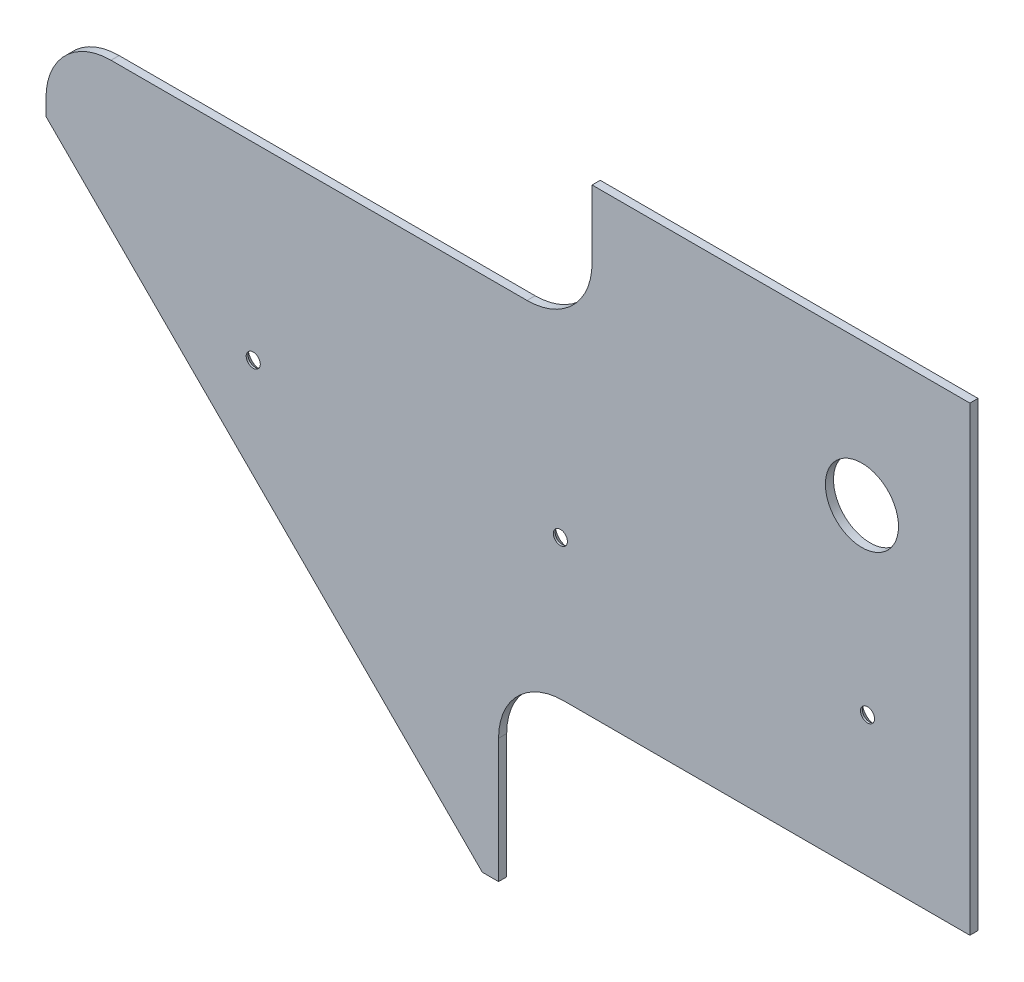
from build123d import *

# Parameters (mm, degrees)
SKETCH1_R                                      = 14.2875
BOSS_EXTRUDE1_DEPTH                            = 3.175
SKETCH2_W                                      = 184.202806358
SKETCH2_H                                      = 73.914
CUT_EXTRUDE1_DEPTH                             = 266.893552722
FILLET1_R                                      = 25.4
SKETCH4_W                                      = 213.36
SKETCH4_H                                      = 64.479988722
CUT_EXTRUDE2_DEPTH                             = 266.893552722
FILLET2_R                                      = 25.4
SKETCH7_W                                      = 147.610011278
SKETCH7_H                                      = 12.7
CUT_EXTRUDE4_DEPTH                             = 266.893552722
CSK_FOR_M5_FLAT_HEAD_MACHINE_SCREW1_AT_2_COUNT = 2
CSK_FOR_M5_FLAT_HEAD_MACHINE_SCREW1_AT_2_PITCH = 120
CSK_FOR_M5_FLAT_HEAD_MACHINE_SCREW1_AT_3_COUNT = 2
CSK_FOR_M5_FLAT_HEAD_MACHINE_SCREW1_AT_3_PITCH = 240


with BuildPart() as part:
    # Sketch1 → Boss-Extrude1 (new body)
    with BuildSketch(Plane.XY):
        Polygon((-138.259383474, 48.991487021), (32.210627804, -121.478524257), (222.710627804, -121.478524257), (222.710627804, 145.221475743), (-138.259383474, 145.221475743), align=None)
        with Locations((180.538014078, 76.831975743)):
            Circle(SKETCH1_R, mode=Mode.SUBTRACT)
    extrude(amount=BOSS_EXTRUDE1_DEPTH)

    # Sketch2 → Cut-Extrude1 (cut, through all)
    with BuildSketch(Plane.XY.offset(3.175)):
        with Locations((130.662030983, -84.521524257)):
            Rectangle(SKETCH2_W, SKETCH2_H)
    extrude(amount=-CUT_EXTRUDE1_DEPTH, mode=Mode.SUBTRACT)

    # Fillet1
    fillet1_edges = [part.edges().sort_by_distance(p)[0] for p in [
        (38.560627804, -47.564524257, 1.5875),
    ]]
    fillet(fillet1_edges, radius=FILLET1_R)

    # Sketch4 → Cut-Extrude2 (cut, through all)
    with BuildSketch(Plane.XY.offset(3.175)):
        with Locations((-31.579383474, 112.981481382)):
            Rectangle(SKETCH4_W, SKETCH4_H)
    extrude(amount=-CUT_EXTRUDE2_DEPTH, mode=Mode.SUBTRACT)

    # Fillet2
    fillet2_edges = [part.edges().sort_by_distance(p)[0] for p in [
        (-138.259383474, 80.741487021, 1.5875),
        (75.100616526, 80.741487021, 1.5875),
    ]]
    fillet(fillet2_edges, radius=FILLET2_R)

    # Sketch7 → Cut-Extrude4 (cut, through all)
    with BuildSketch(Plane.XY.offset(3.175)):
        with Locations((148.905622165, 138.871475743)):
            Rectangle(SKETCH7_W, SKETCH7_H)
    extrude(amount=-CUT_EXTRUDE4_DEPTH, mode=Mode.SUBTRACT)

    # Sketch8 → CSK for M5 Flat Head Machine Screw1 (revolve, cut)
    with BuildSketch(Plane(origin=(182.710627794, 7.042935743, 0), x_dir=(0, 1, 0), z_dir=(1, 0, 0))):
        Polygon((0, 0), (0, 3.175), (2.75, 3.175), (2.75, 2.45), (5.2, 0), align=None)
    csk_for_m5_flat_head_machine_screw1 = revolve(axis=Axis((182.710627794, 7.042935743, -6.35), (0, 0, 1)), mode=Mode.SUBTRACT)

    # CSK for M5 Flat Head Machine Screw1 at 2: CSK for M5 Flat Head Machine Screw1 ×2
    with Locations(*[(-i * CSK_FOR_M5_FLAT_HEAD_MACHINE_SCREW1_AT_2_PITCH, 0, 0) for i in range(1, CSK_FOR_M5_FLAT_HEAD_MACHINE_SCREW1_AT_2_COUNT)]):
        add(csk_for_m5_flat_head_machine_screw1, mode=Mode.SUBTRACT)

    # CSK for M5 Flat Head Machine Screw1 at 3: CSK for M5 Flat Head Machine Screw1 ×2
    with Locations(*[(-i * CSK_FOR_M5_FLAT_HEAD_MACHINE_SCREW1_AT_3_PITCH, 0, 0) for i in range(1, CSK_FOR_M5_FLAT_HEAD_MACHINE_SCREW1_AT_3_COUNT)]):
        add(csk_for_m5_flat_head_machine_screw1, mode=Mode.SUBTRACT)


solid = part.part
